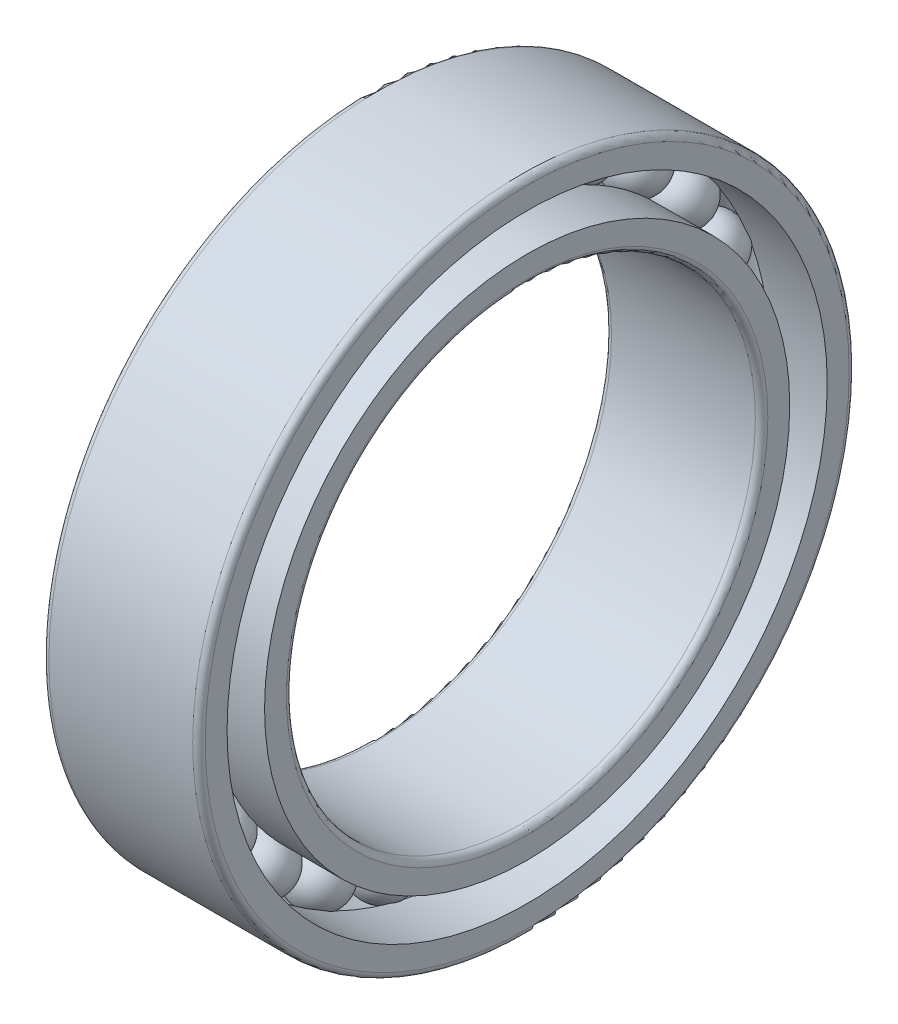
from build123d import *

# Parameters (mm, degrees)
CAGSPISKE_W         = 0.18
CAGSPISKE_H         = 0.3
CAGESPINE_ANGLE     = 0.001
BALLSDETAILED_COUNT = 26
BALLSDETAILED_ANGLE = 346.153846154


with BuildPart() as part:
    # CagSpiSke → CageSpine (revolve)
    with BuildSketch(Plane.XY):
        with Locations((0, 9)):
            Rectangle(CAGSPISKE_W, CAGSPISKE_H)
    revolve(axis=Axis((-20.6375, 0, 0), (-1, 0, 0)), revolution_arc=CAGESPINE_ANGLE)

    # BalDetSke → BallDetailed (revolve)
    with BuildSketch(Plane.XY):
        with BuildLine():
            Line((-0.9, 9), (0.9, 9))
            ThreePointArc((0.9, 9), (0, 8.1), (-0.9, 9))
        make_face()
    balldetailed = revolve(axis=Axis((-1.905, 9, 0), (1, 0, 0)))

    # InnRacSke → InnerRace (revolve)
    with BuildSketch(Plane.XY):
        with BuildLine():
            Line((-0.63688696, 8.4), (-2.5, 8.4))
            Line((-2.5, 8.4), (-2.5, 7.7))
            ThreePointArc((-2.5, 7.7), (-2.441421356, 7.558578644), (-2.3, 7.5))
            Line((-2.3, 7.5), (2.3, 7.5))
            ThreePointArc((2.3, 7.5), (2.441421356, 7.558578644), (2.5, 7.7))
            Line((2.5, 7.7), (2.5, 8.4))
            Line((2.5, 8.4), (0.63688696, 8.4))
            ThreePointArc((0.63688696, 8.4), (0, 8.125), (-0.63688696, 8.4))
        make_face()
    revolve(axis=Axis((-20.6375, 0, 0), (1, 0, 0)))

    # OutRacSke → OuterRace (revolve)
    with BuildSketch(Plane.XY):
        with BuildLine():
            Line((-0.63688696, 9.6), (-2.5, 9.6))
            Line((-2.5, 9.6), (-2.5, 10.3))
            ThreePointArc((-2.5, 10.3), (-2.441421356, 10.441421356), (-2.3, 10.5))
            Line((-2.3, 10.5), (2.3, 10.5))
            ThreePointArc((2.3, 10.5), (2.441421356, 10.441421356), (2.5, 10.3))
            Line((2.5, 10.3), (2.5, 9.6))
            Line((2.5, 9.6), (0.63688696, 9.6))
            ThreePointArc((0.63688696, 9.6), (0, 9.875), (-0.63688696, 9.6))
        make_face()
    revolve(axis=Axis((-20.6375, 0, 0), (1, 0, 0)))

    # BallsDetailed: BallDetailed ×26 about axis
    ballsdetailed_axis = Axis((-50, 0, 0), (1, 0, 0))
    for i in range(1, BALLSDETAILED_COUNT):
        add(balldetailed.rotate(ballsdetailed_axis, i * BALLSDETAILED_ANGLE / (BALLSDETAILED_COUNT - 1)))


solid = part.part
